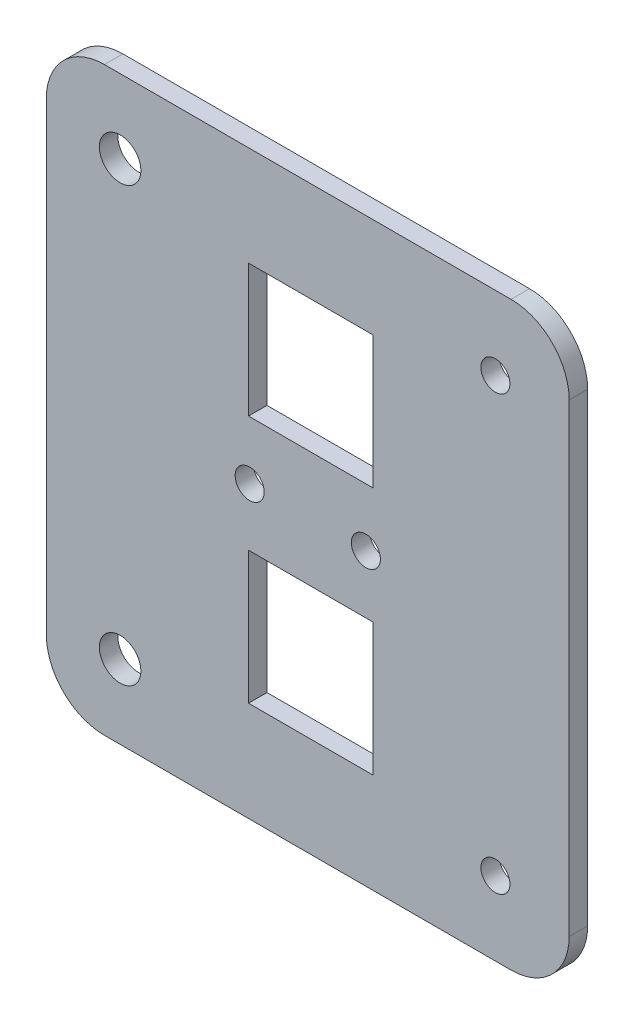
from build123d import *

# Parameters (mm, degrees)
BOSS_EXTRUDE1_START = 19.16
SKETCH1_W           = 90
SKETCH1_H           = 100
SKETCH1_R           = 2.5
SKETCH1_R_2         = 3.57
BOSS_EXTRUDE1_DEPTH = 3.18
FILLET1_R           = 10
SKETCH2_R           = 2.5
CUT_EXTRUDE1_DEPTH  = 10
SKETCH3_W           = 21.4
SKETCH3_H           = 22.810510703
CUT_EXTRUDE2_DEPTH  = 72.134467033


with BuildPart() as part:
    # Sketch1 → Boss-Extrude1 (new body)
    with BuildSketch(Plane.XY.offset(BOSS_EXTRUDE1_START)):
        with Locations((0, -5)):
            Rectangle(SKETCH1_W, SKETCH1_H)
        with Locations((32.3, -42.3)):
            Circle(SKETCH1_R, mode=Mode.SUBTRACT)
        with Locations((-32.3, -42.3)):
            Circle(SKETCH1_R_2, mode=Mode.SUBTRACT)
        with Locations((-32.3, 32.3)):
            Circle(SKETCH1_R_2, mode=Mode.SUBTRACT)
        with Locations((32.3, 32.3)):
            Circle(SKETCH1_R, mode=Mode.SUBTRACT)
    extrude(amount=-BOSS_EXTRUDE1_DEPTH)

    # Fillet1
    fillet1_edges = [part.edges().sort_by_distance(p)[0] for p in [
        (45, -55, 17.57),
        (-45, -55, 17.57),
        (-45, 45, 17.57),
        (45, 45, 17.57),
    ]]
    fillet(fillet1_edges, radius=FILLET1_R)

    # Sketch2 → Cut-Extrude1 (cut)
    with BuildSketch(Plane.XY.offset(19.16)):
        with Locations((10, -5)):
            Circle(SKETCH2_R)
        with Locations((-10, -5)):
            Circle(SKETCH2_R)
    extrude(amount=-CUT_EXTRUDE1_DEPTH, mode=Mode.SUBTRACT)

    # Sketch3 → Cut-Extrude2 (cut, through all)
    with BuildSketch(Plane(origin=(0, 0, 15.98), x_dir=(-1, 0, 0), z_dir=(0, 0, -1))):
        with Locations((-0.5, 16.405255352)):
            Rectangle(SKETCH3_W, SKETCH3_H)
        with Locations((-0.5, -26.405255352)):
            Rectangle(SKETCH3_W, SKETCH3_H)
    extrude(amount=-CUT_EXTRUDE2_DEPTH, mode=Mode.SUBTRACT)


solid = part.part
